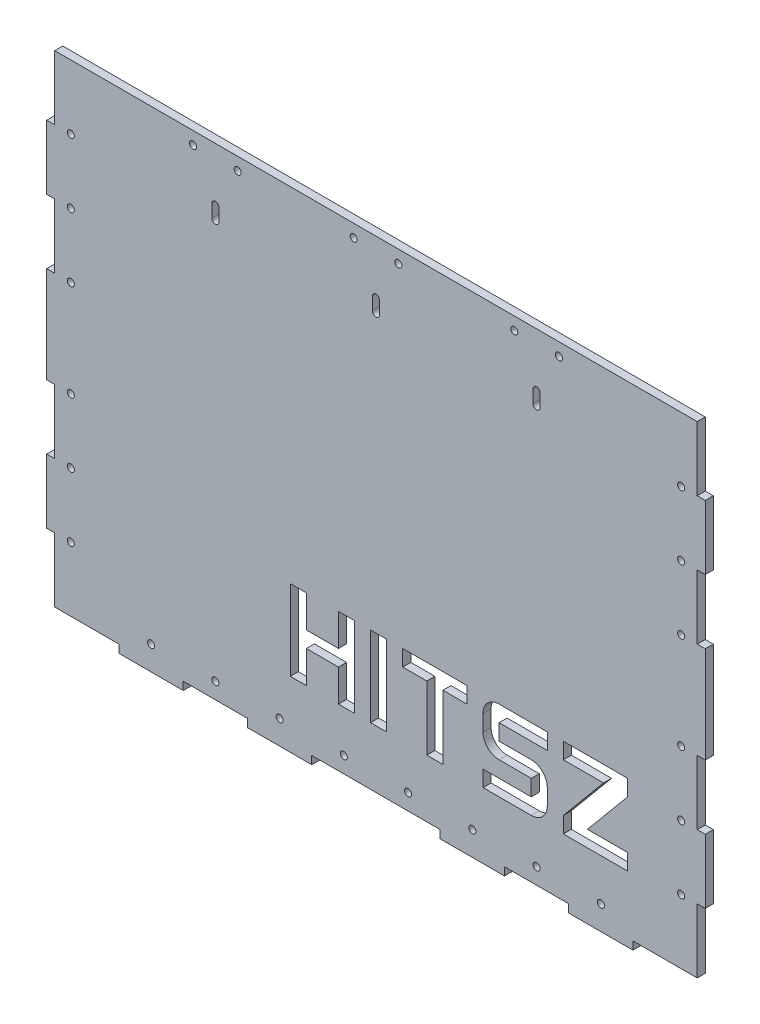
from build123d import *

# Parameters (mm, degrees)
SKETCH_1_R          = 2.2
EXTRUDE_1_DEPTH     = 5
SKETCH_2_W          = 10
SKETCH_2_H          = 50
CUT_EXTRUDE_1_DEPTH = 10
SKETCH_3_R          = 2.2
CUT_EXTRUDE_2_DEPTH = 10


with BuildPart() as part:
    # 草图1 → 凸台-拉伸1 (new body)
    with BuildSketch(Plane.XY):
        Polygon((200, 150), (-200, 150), (-200, 110), (-205, 110), (-205, 70), (-200, 70), (-200, 30), (-205, 30), (-205, -30), (-200, -30), (-200, -70), (-205, -70), (-205, -110), (-200, -110), (-200, -150), (-160, -150), (-160, -155), (-120, -155), (-120, -150), (-80, -150), (-80, -155), (-40, -155), (-40, -150), (40, -150), (40, -155), (80, -155), (80, -150), (120, -150), (120, -155), (160, -155), (160, -150), (200, -150), (200, -110), (205, -110), (205, -70), (200, -70), (200, -30), (205, -30), (205, 30), (200, 30), (200, 70), (205, 70), (205, 110), (200, 110), align=None)
        with Locations((-140, -140)):
            Circle(SKETCH_1_R, mode=Mode.SUBTRACT)
        with Locations((-190, -110)):
            Circle(SKETCH_1_R, mode=Mode.SUBTRACT)
        with Locations((-100, -140)):
            Circle(SKETCH_1_R, mode=Mode.SUBTRACT)
        with Locations((-60, -140)):
            Circle(SKETCH_1_R, mode=Mode.SUBTRACT)
        with Locations((-20, -140)):
            Circle(SKETCH_1_R, mode=Mode.SUBTRACT)
        with Locations((-190, -70)):
            Circle(SKETCH_1_R, mode=Mode.SUBTRACT)
        with Locations((-190, -30)):
            Circle(SKETCH_1_R, mode=Mode.SUBTRACT)
        with Locations((20, -140)):
            Circle(SKETCH_1_R, mode=Mode.SUBTRACT)
        with Locations((60, -140)):
            Circle(SKETCH_1_R, mode=Mode.SUBTRACT)
        with Locations((100, -140)):
            Circle(SKETCH_1_R, mode=Mode.SUBTRACT)
        with Locations((140, -140)):
            Circle(SKETCH_1_R, mode=Mode.SUBTRACT)
        with Locations((190, -110)):
            Circle(SKETCH_1_R, mode=Mode.SUBTRACT)
        with Locations((190, -70)):
            Circle(SKETCH_1_R, mode=Mode.SUBTRACT)
        with Locations((190, -30)):
            Circle(SKETCH_1_R, mode=Mode.SUBTRACT)
        with Locations((-190, 30)):
            Circle(SKETCH_1_R, mode=Mode.SUBTRACT)
        with Locations((-190, 70)):
            Circle(SKETCH_1_R, mode=Mode.SUBTRACT)
        with Locations((-190, 110)):
            Circle(SKETCH_1_R, mode=Mode.SUBTRACT)
        with Locations((190, 30)):
            Circle(SKETCH_1_R, mode=Mode.SUBTRACT)
        with Locations((190, 70)):
            Circle(SKETCH_1_R, mode=Mode.SUBTRACT)
        with Locations((190, 110)):
            Circle(SKETCH_1_R, mode=Mode.SUBTRACT)
    extrude(amount=EXTRUDE_1_DEPTH)

    # 草图2 → 切除-拉伸1 (cut)
    with BuildSketch(Plane.XY.offset(5)):
        Polygon((-23.354341751, -114.01705299), (-13.354341751, -114.01705299), (-13.354341751, -64.01705299), (-23.354341751, -64.01705299), (-23.354341751, -84.01705299), (-43.354341751, -84.01705299), (-43.354341751, -64.01705299), (-53.354341751, -64.01705299), (-53.354341751, -114.01705299), (-43.354341751, -114.01705299), (-43.354341751, -94.01705299), (-23.354341751, -94.01705299), align=None)
        with Locations((1.645658249, -89.01705299)):
            Rectangle(SKETCH_2_W, SKETCH_2_H)
        Polygon((16.645658249, -64.01705299), (16.645658249, -74.01705299), (31.645658249, -74.01705299), (31.645658249, -114.01705299), (41.645658249, -114.01705299), (41.645658249, -74.01705299), (56.645658249, -74.01705299), (56.645658249, -64.01705299), align=None)
        with BuildLine():
            Line((66.645658249, -74.01705299), (66.645658249, -84.01705299))
            ThreePointArc((66.645658249, -84.01705299), (69.574590437, -91.088120802), (76.645658249, -94.01705299))
            Line((76.645658249, -94.01705299), (96.645658249, -94.01705299))
            Line((96.645658249, -94.01705299), (96.645658249, -104.01705299))
            Line((96.645658249, -104.01705299), (66.645658249, -104.01705299))
            Line((66.645658249, -104.01705299), (66.645658249, -114.01705299))
            Line((66.645658249, -114.01705299), (96.645658249, -114.01705299))
            ThreePointArc((96.645658249, -114.01705299), (103.716726061, -111.088120802), (106.645658249, -104.01705299))
            Line((106.645658249, -104.01705299), (106.645658249, -94.01705299))
            ThreePointArc((106.645658249, -94.01705299), (103.716726061, -86.945985178), (96.645658249, -84.01705299))
            Line((96.645658249, -84.01705299), (76.645658249, -84.01705299))
            Line((76.645658249, -84.01705299), (76.645658249, -74.01705299))
            Line((76.645658249, -74.01705299), (106.645658249, -74.01705299))
            Line((106.645658249, -74.01705299), (106.645658249, -64.01705299))
            Line((106.645658249, -64.01705299), (76.645658249, -64.01705299))
            ThreePointArc((76.645658249, -64.01705299), (69.574590437, -66.945985178), (66.645658249, -74.01705299))
        make_face()
        Polygon((116.645658249, -64.01705299), (116.645658249, -74.01705299), (141.645658249, -74.01705299), (116.645658249, -104.01705299), (116.645658249, -114.01705299), (156.645658249, -114.01705299), (156.645658249, -104.01705299), (131.645658249, -104.01705299), (156.645658249, -74.01705299), (156.645658249, -64.01705299), align=None)
    extrude(amount=-CUT_EXTRUDE_1_DEPTH, mode=Mode.SUBTRACT)

    # 草图3 → 切除-拉伸2 (cut)
    with BuildSketch(Plane.XY.offset(5)):
        with Locations((-13.9, 142.1)):
            Circle(SKETCH_3_R)
        with Locations((13.9, 142.1)):
            Circle(SKETCH_3_R)
        with Locations((86.1, 142.1)):
            Circle(SKETCH_3_R)
        with Locations((113.9, 142.1)):
            Circle(SKETCH_3_R)
        with Locations((-113.9, 142.1)):
            Circle(SKETCH_3_R)
        with Locations((-86.1, 142.1)):
            Circle(SKETCH_3_R)
        with BuildLine():
            Line((102.2, 116.6), (102.2, 108.6))
            ThreePointArc((102.2, 108.6), (100, 106.4), (97.8, 108.6))
            Line((97.8, 108.6), (97.8, 116.6))
            ThreePointArc((97.8, 116.6), (100, 118.8), (102.2, 116.6))
        make_face()
        with BuildLine():
            Line((2.2, 116.6), (2.2, 108.6))
            ThreePointArc((2.2, 108.6), (0, 106.4), (-2.2, 108.6))
            Line((-2.2, 108.6), (-2.2, 116.6))
            ThreePointArc((-2.2, 116.6), (0, 118.8), (2.2, 116.6))
        make_face()
        with BuildLine():
            Line((-102.2, 116.6), (-102.2, 108.6))
            ThreePointArc((-102.2, 108.6), (-100, 106.4), (-97.8, 108.6))
            Line((-97.8, 108.6), (-97.8, 116.6))
            ThreePointArc((-97.8, 116.6), (-100, 118.8), (-102.2, 116.6))
        make_face()
    extrude(amount=-CUT_EXTRUDE_2_DEPTH, mode=Mode.SUBTRACT)


solid = part.part
